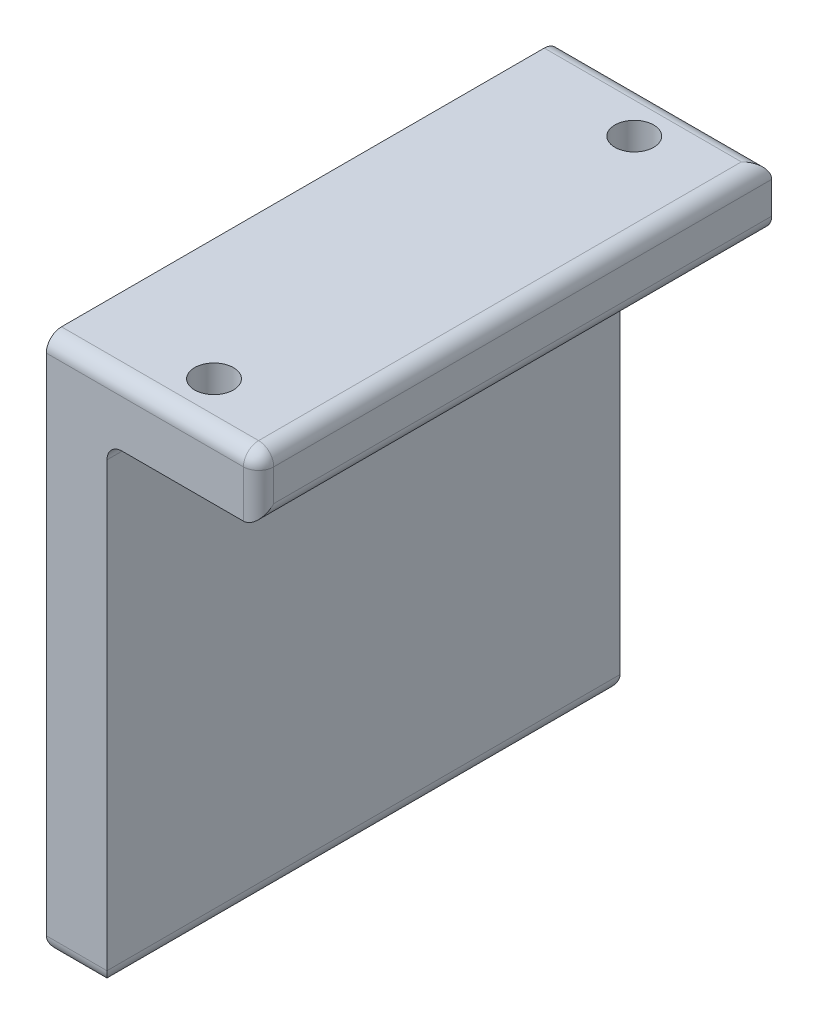
from build123d import *

# Parameters (mm, degrees)
SKETCH1_W           = 429.768
SKETCH1_H           = 448.056
SKETCH1_R           = 16.256
BOSS_EXTRUDE1_DEPTH = 50.8
SKETCH2_W           = 429.768
SKETCH2_H           = 52.07
BOSS_EXTRUDE2_DEPTH = 127
SKETCH3_R           = 16.256
CUT_EXTRUDE1_DEPTH  = 76.2
FILLET1_R           = 12.7


with BuildPart() as part:
    # Sketch1 → Boss-Extrude1 (new body)
    with BuildSketch(Plane(origin=(0, 0, 0), x_dir=(0, 0, -1), z_dir=(1, 0, 0))):
        Rectangle(SKETCH1_W, SKETCH1_H)
        with Locations((-173.99, 183.134)):
            Circle(SKETCH1_R, mode=Mode.SUBTRACT)
        with Locations((173.99, 183.134)):
            Circle(SKETCH1_R, mode=Mode.SUBTRACT)
    extrude(amount=BOSS_EXTRUDE1_DEPTH)

    # Sketch2 → Boss-Extrude2 (add)
    with BuildSketch(Plane(origin=(50.8, 0, 0), x_dir=(0, 0, -1), z_dir=(1, 0, 0))):
        with Locations((0, 197.993)):
            Rectangle(SKETCH2_W, SKETCH2_H)
    extrude(amount=BOSS_EXTRUDE2_DEPTH)

    # Sketch3 → Cut-Extrude1 (cut)
    with BuildSketch(Plane(origin=(0, 224.028, 0), x_dir=(1, 0, 0), z_dir=(0, 1, 0))):
        with Locations(Location((101.6, 176.012040492, 0), (0, 0, 270))):
            Circle(SKETCH3_R)
        with Locations(Location((101.6, -176.012040492, 0), (0, 0, 270))):
            Circle(SKETCH3_R)
    extrude(amount=-CUT_EXTRUDE1_DEPTH, mode=Mode.SUBTRACT)

    # Fillet1
    # the kernel refuses this fillet: 12.7 mm, written as the material it adds along each edge
    with BuildSketch(Plane(origin=(50.8, 171.958, -214.884), x_dir=(0, -1, 0), z_dir=(0, 0, 1))) as fillet1_piece_1_section:
        with BuildLine():
            CenterArc((FILLET1_R, FILLET1_R), FILLET1_R, 180, 90)
            Line((0, FILLET1_R), (0, 0))
            Line((0, 0), (FILLET1_R, 0))
        make_face()
    fillet1_piece_1 = extrude(amount=60.839146761, mode=Mode.PRIVATE)
    fillet1_piece_1 = fillet1_piece_1 - Plane(origin=(53.390848129, 183.134, -173.99), x_dir=(0, 0, -1), z_dir=(-1, 0, 0)) * Cylinder(16.256, 173, mode=Mode.PRIVATE)
    add(fillet1_piece_1)
    with BuildSketch(Plane(origin=(50.8, 171.958, -193.935146761), x_dir=(0, -1, 0), z_dir=(0, 0, 1))) as fillet1_piece_2_section:
        with BuildLine():
            CenterArc((FILLET1_R, FILLET1_R), FILLET1_R, 180, 90)
            Line((0, FILLET1_R), (0, 0))
            Line((0, 0), (FILLET1_R, 0))
        make_face()
    fillet1_piece_2 = extrude(amount=387.870293522, mode=Mode.PRIVATE)
    fillet1_piece_2 = fillet1_piece_2 - Plane(origin=(53.573862422, 183.134, 173.99), x_dir=(0, 0, -1), z_dir=(-1, 0, 0)) * Cylinder(16.256, 827, mode=Mode.PRIVATE)
    fillet1_piece_2 = fillet1_piece_2 - Plane(origin=(53.573862422, 183.134, -173.99), x_dir=(0, 0, -1), z_dir=(-1, 0, 0)) * Cylinder(16.256, 827, mode=Mode.PRIVATE)
    add(fillet1_piece_2)
    with BuildSketch(Plane(origin=(50.8, 171.958, 154.044853239), x_dir=(0, -1, 0), z_dir=(0, 0, 1))) as fillet1_piece_3_section:
        with BuildLine():
            CenterArc((FILLET1_R, FILLET1_R), FILLET1_R, 180, 90)
            Line((0, FILLET1_R), (0, 0))
            Line((0, 0), (FILLET1_R, 0))
        make_face()
    fillet1_piece_3 = extrude(amount=60.839146761, mode=Mode.PRIVATE)
    fillet1_piece_3 = fillet1_piece_3 - Plane(origin=(53.390848027, 183.134, 173.99), x_dir=(0, 0, -1), z_dir=(-1, 0, 0)) * Cylinder(16.256, 173, mode=Mode.PRIVATE)
    add(fillet1_piece_3)
    # the kernel refuses this fillet: 12.7 mm, written as the material it takes off along each edge
    with BuildSketch(Plane(origin=(165.1, 211.328, 202.184), x_dir=(1, 0, 0), z_dir=(0, 1, 0))) as fillet1_2_piece_1_section:
        Polygon((0, 0), (FILLET1_R * 1.02, 0), (FILLET1_R * 1.02, -FILLET1_R * 1.02), (0, -FILLET1_R * 1.02), align=None)
    fillet1_2_piece_1 = extrude(amount=FILLET1_R * 1.02, mode=Mode.PRIVATE)
    fillet1_2_piece_1 = fillet1_2_piece_1 - Plane(origin=(165.1, 211.328, 202.184), x_dir=(-0.7071067811865475, 0, -0.7071067811865475), z_dir=(0, 1, 0)) * Sphere(FILLET1_R, mode=Mode.PRIVATE)
    add(fillet1_2_piece_1, mode=Mode.SUBTRACT)
    with BuildSketch(Plane(origin=(-31.75, -224.028, -214.884), x_dir=(0, 0, 1), z_dir=(1, 0, 0))) as fillet1_2_piece_2:
        with BuildLine():
            CenterArc((FILLET1_R, -FILLET1_R), FILLET1_R, 90, 90)
            Line((0, -FILLET1_R), (0, 0))
            Line((0, 0), (FILLET1_R, 0))
        make_face()
    extrude(amount=114.3, mode=Mode.SUBTRACT)
    with BuildSketch(Plane(origin=(-31.75, -224.028, 214.884), x_dir=(0, 0, -1), z_dir=(1, 0, 0))) as fillet1_2_piece_3:
        with BuildLine():
            CenterArc((FILLET1_R, FILLET1_R), FILLET1_R, 180, 90)
            Line((0, FILLET1_R), (0, 0))
            Line((0, 0), (FILLET1_R, 0))
        make_face()
    extrude(amount=114.3, mode=Mode.SUBTRACT)
    with BuildSketch(Plane(origin=(165.1, 224.028, 214.884), x_dir=(0, 0, -1), z_dir=(-1, 0, 0))) as fillet1_2_piece_4:
        with BuildLine():
            CenterArc((FILLET1_R, FILLET1_R), FILLET1_R, 180, 90)
            Line((0, FILLET1_R), (0, 0))
            Line((0, 0), (FILLET1_R, 0))
        make_face()
    extrude(amount=196.85, mode=Mode.SUBTRACT)
    with BuildSketch(Plane(origin=(-31.75, 224.028, -214.884), x_dir=(0, 0, 1), z_dir=(1, 0, 0))) as fillet1_2_piece_5:
        with BuildLine():
            CenterArc((FILLET1_R, FILLET1_R), FILLET1_R, 180, 90)
            Line((0, FILLET1_R), (0, 0))
            Line((0, 0), (FILLET1_R, 0))
        make_face()
    extrude(amount=241.3, mode=Mode.SUBTRACT)
    with BuildSketch(Plane(origin=(177.8, 140.208, 214.884), x_dir=(0, 0, -1), z_dir=(0, 1, 0))) as fillet1_2_piece_6:
        with BuildLine():
            CenterArc((FILLET1_R, FILLET1_R), FILLET1_R, 180, 90)
            Line((0, FILLET1_R), (0, 0))
            Line((0, 0), (FILLET1_R, 0))
        make_face()
    extrude(amount=71.12, mode=Mode.SUBTRACT)
    with BuildSketch(Plane(origin=(177.8, 171.958, -246.634), x_dir=(-1, 0, 0), z_dir=(0, 0, 1)), Plane(origin=(0, -224.028, 246.634), x_dir=(1, 0, 0), z_dir=(0, 0, -1))) as fillet1_2_piece_7:
        with BuildLine():
            CenterArc((FILLET1_R, -FILLET1_R), FILLET1_R, 90, 90)
            Line((0, -FILLET1_R), (0, 0))
            Line((0, 0), (FILLET1_R, 0))
        make_face()
    extrude(amount=493.268, mode=Mode.SUBTRACT)
    with BuildSketch(Plane(origin=(177.8, 224.028, 202.184), x_dir=(-1, 0, 0), z_dir=(0, 0, -1))) as fillet1_2_piece_8:
        with BuildLine():
            CenterArc((FILLET1_R, -FILLET1_R), FILLET1_R, 90, 90)
            Line((0, -FILLET1_R), (0, 0))
            Line((0, 0), (FILLET1_R, 0))
        make_face()
    extrude(amount=448.818, mode=Mode.SUBTRACT)
    with BuildSketch(Plane(origin=(50.8, -224.028, 246.634), x_dir=(-1, 0, 0), z_dir=(0, 0, -1))) as fillet1_2_piece_9:
        with BuildLine():
            CenterArc((FILLET1_R, FILLET1_R), FILLET1_R, 180, 90)
            Line((0, FILLET1_R), (0, 0))
            Line((0, 0), (FILLET1_R, 0))
        make_face()
    extrude(amount=493.268, mode=Mode.SUBTRACT)


solid = part.part
